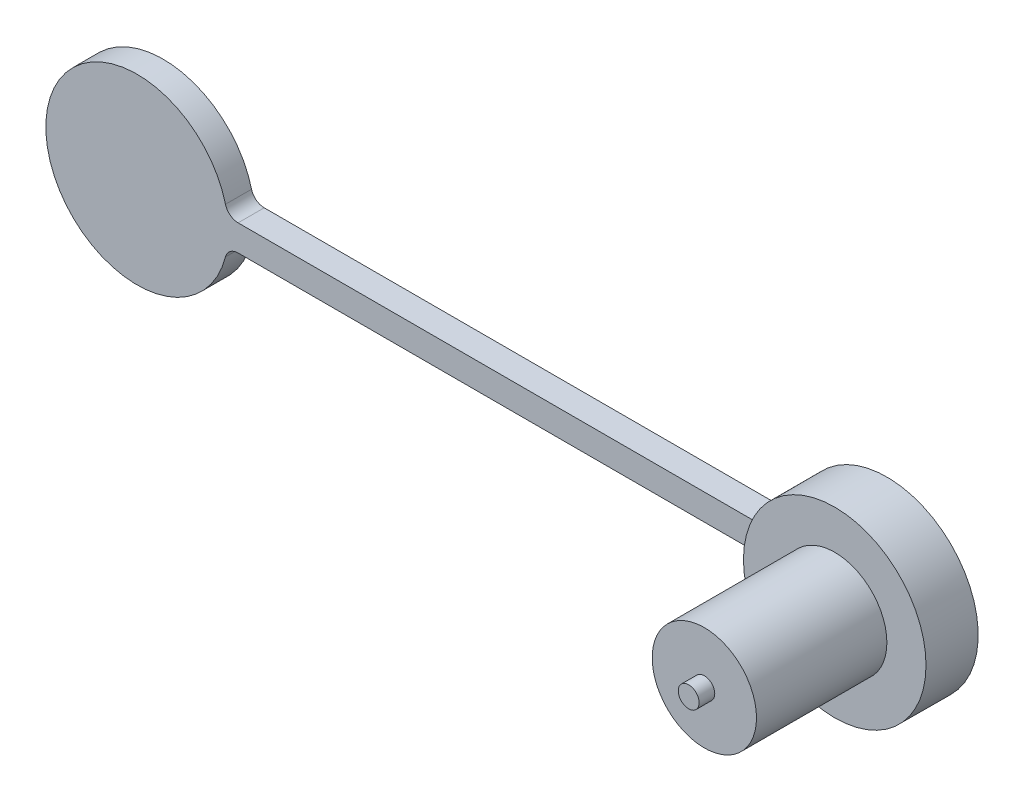
from build123d import *

# Parameters (mm, degrees)
ESBO_O1_R                     = 35
RESSALTO_EXTRUS_O1_DEPTH      = 10
ESBO_O4_W                     = 10
ESBO_O4_H                     = 10
RESSALTO_EXTRUS_O2_DEPTH      = 277.5
FILETE3_R                     = 5
FILETE4_R                     = 5
RESSALTO_EXTRUS_O3_DEPTH      = 10
RESSALTO_EXTRUS_O3_DEPTH_BACK = 10
ESBO_O6_R                     = 35
FILETE5_R                     = 5
FILETE6_R                     = 5
ESBO_O7_R                     = 20
RESSALTO_EXTRUS_O4_DEPTH      = 50
SMLINK_BETA_CIRCLE_R          = 4
SMLINK_BETA_CYLINDER_DEPTH    = 6


with BuildPart() as part:
    # Esboço1 → Ressalto-extrusão1 (new body)
    with BuildSketch(Plane(origin=(0, 0, 0), x_dir=(0, 1, 0), z_dir=(0, 0, 1))):
        with Locations(Location((0, 0, 0), (0, 0, 270))):
            Circle(ESBO_O1_R)
    extrude(amount=RESSALTO_EXTRUS_O1_DEPTH)

    # Esboço4 → Ressalto-extrusão2 (add)
    with BuildSketch(Plane.YZ):
        with Locations((0, 5)):
            Rectangle(ESBO_O4_W, ESBO_O4_H)
    extrude(amount=RESSALTO_EXTRUS_O2_DEPTH)

    # Filete3
    filete3_edges = [part.edges().sort_by_distance(p)[0] for p in [
        (34.641016151, -5, 5),
    ]]
    fillet(filete3_edges, radius=FILETE3_R)

    # Filete4
    filete4_edges = [part.edges().sort_by_distance(p)[0] for p in [
        (34.641016151, 5, 5),
    ]]
    fillet(filete4_edges, radius=FILETE4_R)

    # Esboço6 → Ressalto-extrusão3 (add, two sides: drawn at the far end of the back side and taken through both)
    with BuildSketch(Plane.XY.offset(10).offset(-RESSALTO_EXTRUS_O3_DEPTH_BACK)):
        with Locations(Location((277.5, 0, 0), (0, 0, 171.786789298))):
            Circle(ESBO_O6_R)
    extrude(amount=RESSALTO_EXTRUS_O3_DEPTH + RESSALTO_EXTRUS_O3_DEPTH_BACK)

    # Filete5
    filete5_edges = [part.edges().sort_by_distance(p)[0] for p in [
        (242.858983849, -5, 5),
    ]]
    fillet(filete5_edges, radius=FILETE5_R)

    # Filete6
    # the kernel refuses this fillet: 5 mm, written as the material it adds along each edge
    with BuildSketch(Plane(origin=(242.858983849, 5, 10), x_dir=(0.1967224418008006, 0.9804592193925918, 0), z_dir=(0, 0, -1))) as filete6_piece_1:
        with BuildLine():
            CenterArc((4.097933971, -4.992530838), FILETE6_R, 93.132150742, 75.522487814)
            Line((-0.804362126, -4.008918629), (0, 0))
            ThreePointArc((0, 0), (1.912369187, -0.052284136), (3.824738373, 0))
        make_face()
    extrude(amount=10)

    # Esboço7 → Ressalto-extrusão4 (add)
    with BuildSketch(Plane.XY.offset(20)):
        with Locations((277.5, 0)):
            Circle(ESBO_O7_R)
    extrude(amount=RESSALTO_EXTRUS_O4_DEPTH)


with BuildPart() as body_2:
    # SMLINK_BETA_CIRCLE → SMLINK_BETA_CYLINDER (new body)
    with BuildSketch(Plane(origin=(0, 0, 70), x_dir=(0, 1, 0), z_dir=(0, 0, 1))):
        with Locations(Location((0, -277.5, 0), (0, 0, 270))):
            Circle(SMLINK_BETA_CIRCLE_R)
    extrude(amount=SMLINK_BETA_CYLINDER_DEPTH)


solid = Compound([part.part, body_2.part])
